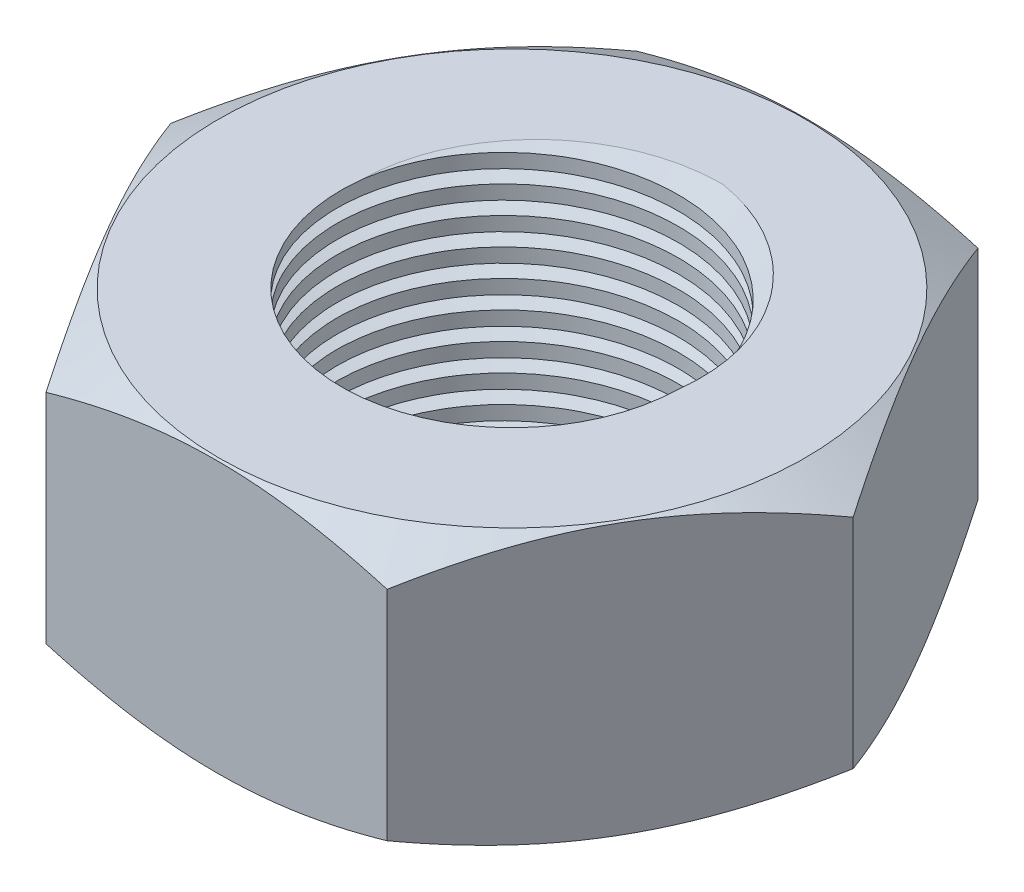
from build123d import *

# Parameters (mm, degrees)
BOSS_EXTRUDE1_DEPTH = 4
SKETCH2_OUTSIDE_W   = 153.328
SKETCH2_OUTSIDE_H   = 151.988
SKETCH2_OUTSIDE_R   = 4.3
CUT_EXTRUDE1_DEPTH  = 40
CUT_EXTRUDE1_DRAFT  = -60
SKETCH3_OUTSIDE_W   = 153.328
SKETCH3_OUTSIDE_H   = 151.988
SKETCH3_OUTSIDE_R   = 4.3
CUT_EXTRUDE2_DEPTH  = 40
CUT_EXTRUDE2_DRAFT  = -60
SKETCH4_R           = 2.5
CUT_EXTRUDE3_DEPTH  = 8.729812417
CUT_SWEEP3_PITCH    = 0.4


with BuildPart() as part:
    # Sketch1 → Boss-Extrude1 (new body)
    with BuildSketch(Plane(origin=(0, 0, 0), x_dir=(1, 0, 0), z_dir=(0, 1, 0))):
        Polygon((5, 0), (2.5, 4.330127019), (-2.5, 4.330127019), (-5, 0), (-2.5, -4.330127019), (2.5, -4.330127019), align=None)
    extrude(amount=BOSS_EXTRUDE1_DEPTH)


with BuildPart() as cut_extrude1_tool:
    # Sketch2 outside → Cut-Extrude1 (with draft: the straight prism first)
    with BuildSketch(Plane(origin=(0, 4, 0), x_dir=(-1, 0, 0), z_dir=(0, 1, 0))):
        Rectangle(SKETCH2_OUTSIDE_W, SKETCH2_OUTSIDE_H)
        Circle(SKETCH2_OUTSIDE_R, mode=Mode.SUBTRACT)
    extrude(amount=-CUT_EXTRUDE1_DEPTH)
    # Cut-Extrude1: the draft: its side faces are tilted about the plane it starts from
    cut_extrude1_sides = [cut_extrude1_tool.faces().sort_by_distance(p)[0] for p in [
        (0, -16, -75.994),
        (-76.664, -16, 0),
        (0, -16, 75.994),
        (76.664, -16, 0),
        (4.3, -16, 0),
    ]]
    draft(cut_extrude1_sides, Plane(origin=(0, 4, 0), x_dir=(-1, 0, 0), z_dir=(0, 1, 0)), CUT_EXTRUDE1_DRAFT)


with BuildPart() as part_1:
    add(part.part)

    # Cut-Extrude1: cut by cut_extrude1_tool
    add(cut_extrude1_tool.part, mode=Mode.SUBTRACT)


with BuildPart() as cut_extrude2_tool:
    # Sketch3 outside → Cut-Extrude2 (with draft: the straight prism first)
    with BuildSketch(Plane.XZ):
        Rectangle(SKETCH3_OUTSIDE_W, SKETCH3_OUTSIDE_H)
        Circle(SKETCH3_OUTSIDE_R, mode=Mode.SUBTRACT)
    extrude(amount=-CUT_EXTRUDE2_DEPTH)
    # Cut-Extrude2: the draft: its side faces are tilted about the plane it starts from
    cut_extrude2_sides = [cut_extrude2_tool.faces().sort_by_distance(p)[0] for p in [
        (0, 20, -75.994),
        (76.664, 20, 0),
        (0, 20, 75.994),
        (-76.664, 20, 0),
        (-4.3, 20, 0),
    ]]
    draft(cut_extrude2_sides, Plane.XZ, CUT_EXTRUDE2_DRAFT)


with BuildPart() as part_2:
    add(part_1.part)

    # Cut-Extrude2: cut by cut_extrude2_tool
    add(cut_extrude2_tool.part, mode=Mode.SUBTRACT)

    # Sketch4 → Cut-Extrude3 (cut, through all)
    with BuildSketch(Plane.XZ):
        with Locations(Location((0, 0, 0), (0, 0, 270))):
            Circle(SKETCH4_R)
    extrude(amount=-CUT_EXTRUDE3_DEPTH, mode=Mode.SUBTRACT)

    # Cut-Sweep3: arcs per turn and ends read off the stored shape
    # Cut-Sweep3: the profile of Sketch6 profile screwed along a right-hand helix through 100 turns, 6 arcs to a turn; built about Z, then put on its axis
    cut_sweep3_z = Axis((0, 0, 0), (0, 0, 1))
    cut_sweep3_corners = [(2.4997, 0, 0.101347862), (2.4997, 0, -0.092253849), (2.875517265, 0, 0.004547006)]
    with BuildLine(mode=Mode.PRIVATE) as cut_sweep3_profile:
        Line(cut_sweep3_corners[0], cut_sweep3_corners[1])
        Line(cut_sweep3_corners[1], cut_sweep3_corners[2])
        Line(cut_sweep3_corners[2], cut_sweep3_corners[0])
    cut_sweep3_cap = Face(cut_sweep3_profile.wire())
    cut_sweep3_turn_angles = [0, 30, 60, 90, 120, 150, 180, 210, 240, 270, 300, 330, 360]
    cut_sweep3_turn_weights = [1, 0.8660254037844387, 1, 0.8660254037844387, 1, 0.8660254037844387, 1, 0.8660254037844387, 1, 0.8660254037844387, 1, 0.8660254037844387, 1]
    cut_sweep3_turn_rails = [Edge.make_bspline([Vector(p[0], p[1], 0).rotate(cut_sweep3_z, cut_sweep3_turn_angles[k]) / cut_sweep3_turn_weights[k] + Vector(0, 0, p[2] + CUT_SWEEP3_PITCH * cut_sweep3_turn_angles[k] / 360) for k in range(13)], [0, 0, 0, 1, 1, 2, 2, 3, 3, 4, 4, 5, 5, 6, 6, 6], 2, cut_sweep3_turn_weights) for p in cut_sweep3_corners]
    cut_sweep3_turn_sides = [Face.make_surface_from_curves(cut_sweep3_turn_rails[p[0]], cut_sweep3_turn_rails[p[1]]) for p in [(0, 1), (1, 2), (2, 0)]]
    cut_sweep3 = Plane(origin=(0, 0, 0), x_dir=(0, 0, -1), z_dir=(0, 1, 0)) * Solid(Shell([*[p.moved(Location((0, 0, CUT_SWEEP3_PITCH * i))) for i in range(100) for p in cut_sweep3_turn_sides], cut_sweep3_cap, cut_sweep3_cap.rotate(cut_sweep3_z, 36000).moved(Location((0, 0, CUT_SWEEP3_PITCH * 36000 / 360)))]))
    add(cut_sweep3, mode=Mode.SUBTRACT)


solid = part_2.part
